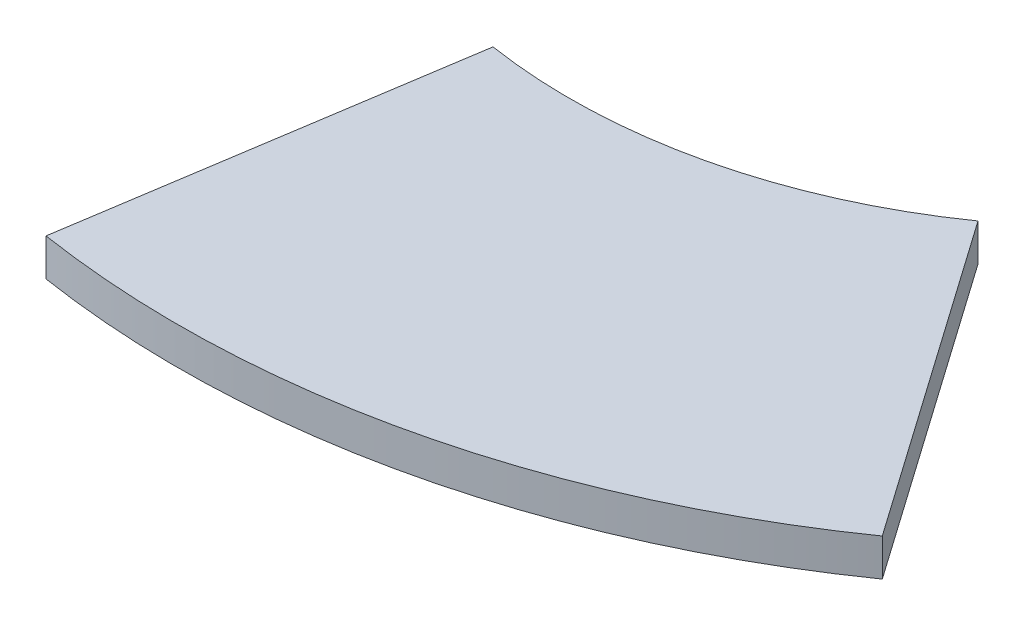
from build123d import *

# Parameters (mm, degrees)
BOSS_EXTRUDE1_DEPTH = 4


with BuildPart() as part:
    # Sketch1 → Boss-Extrude1 (new body)
    with BuildSketch(Plane(origin=(0, 0, 0), x_dir=(1, 0, 0), z_dir=(0, 1, 0))):
        with BuildLine():
            Line((-15.263114979, -98.828322465), (-8.852606688, -57.320427029))
            ThreePointArc((-8.852606688, -57.320427029), (13.180837066, -56.482435626), (33.309348659, -47.481441553))
            Line((33.309348659, -47.481441553), (57.429911481, -81.864554401))
            ThreePointArc((57.429911481, -81.864554401), (22.725581149, -97.3835097), (-15.263114979, -98.828322465))
        make_face()
    extrude(amount=BOSS_EXTRUDE1_DEPTH)


solid = part.part
